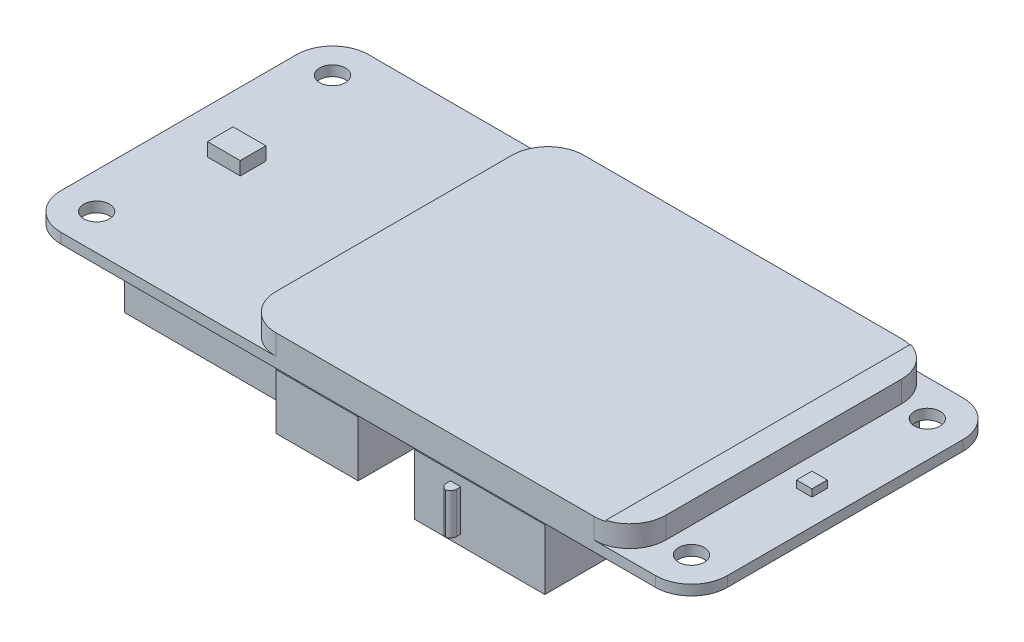
from build123d import *

# Parameters (mm, degrees)
SKETCH_1_R         = 1.25
BOARD_DEPTH        = 1
SKETCH_2_W         = 38
SKETCH_2_H         = 30
SCREEN_DEPTH       = 2
SCREEN_RADIUS_R    = 3.5
SCREEN_TOP_START   = 0.1
SCREEN_TOP_DEPTH   = 0.1
SKETCH_3_W         = 51
SKETCH_3_H         = 5
PLUG_DEPTH         = 5.2
SKETCH_4_W         = 15.14
SKETCH_4_H         = 20
SPEAKER_DEPTH      = 5
SKETCH_10_W        = 8
SKETCH_10_H        = 6
SPEAKER2PLUG_DEPTH = 5.5
SKETCH_5_W         = 12.7
SKETCH_5_H         = 6
BUTTON_DEPTH       = 6
SKETCH_6_W         = 1
SKETCH_6_H         = 4
BUTTON_TAP_DEPTH   = 1
TAP_RADIUS_R       = 0.6
SKETCH_7_W         = 1.5
SKETCH_7_H         = 1.5
RGB_LED_DEPTH      = 0.7
SKETCH_8_W         = 3.2
SKETCH_8_H         = 2.5
MIC_DEPTH          = 1.3
SKETCH_11_W        = 26.2
SKETCH_11_H        = 0.1
SPLIT_2_DEPTH      = 1


with BuildPart() as part:
    # 草图1 → board (new body)
    with BuildSketch(Plane(origin=(0, 0, 0), x_dir=(1, 0, 0), z_dir=(0, 1, 0))):
        with BuildLine():
            Line((-29, 15), (29, 15))
            ThreePointArc((29, 15), (31.474873734, 13.974873734), (32.5, 11.5))
            Line((32.5, 11.5), (32.5, -11.5))
            ThreePointArc((32.5, -11.5), (31.474873734, -13.974873734), (29, -15))
            Line((29, -15), (-29, -15))
            ThreePointArc((-29, -15), (-31.474873734, -13.974873734), (-32.5, -11.5))
            Line((-32.5, -11.5), (-32.5, 11.5))
            ThreePointArc((-32.5, 11.5), (-31.474873734, 13.974873734), (-29, 15))
        make_face()
        with Locations(Location((-29, 11.5, 0), (0, 0, 270))):
            Circle(SKETCH_1_R, mode=Mode.SUBTRACT)
        with Locations(Location((29, 11.5, 0), (0, 0, 270))):
            Circle(SKETCH_1_R, mode=Mode.SUBTRACT)
        with Locations(Location((-29, -11.5, 0), (0, 0, 270))):
            Circle(SKETCH_1_R, mode=Mode.SUBTRACT)
        with Locations(Location((29, -11.5, 0), (0, 0, 270))):
            Circle(SKETCH_1_R, mode=Mode.SUBTRACT)
    extrude(amount=BOARD_DEPTH)

    # 草图2 → screen (add)
    with BuildSketch(Plane(origin=(0, 1, 0), x_dir=(1, 0, 0), z_dir=(0, 1, 0))):
        with Locations((7.5, 0)):
            Rectangle(SKETCH_2_W, SKETCH_2_H)
    extrude(amount=SCREEN_DEPTH)

    # screen-radius
    screen_radius_edges = [part.edges().sort_by_distance(p)[0] for p in [
        (-11.5, 2, -15),
        (-11.5, 2, 15),
        (26.5, 2, 15),
        (26.5, 2, -15),
    ]]
    fillet(screen_radius_edges, radius=SCREEN_RADIUS_R)

    # 草图9 → screen-top (add)
    with BuildSketch(Plane(origin=(0, 3, 0), x_dir=(1, 0, 0), z_dir=(0, 1, 0)).offset(SCREEN_TOP_START)):
        with BuildLine():
            Line((26.5, -11.5), (26.5, 11.5))
            ThreePointArc((26.5, 11.5), (25.80624304, 13.591650066), (24, 14.854101966))
            Line((24, 14.854101966), (24, -14.854101966))
            ThreePointArc((24, -14.854101966), (25.80624304, -13.591650066), (26.5, -11.5))
        make_face()
    extrude(amount=-SCREEN_TOP_DEPTH)

    # 草图3 → plug (add)
    with BuildSketch(Plane.XZ):
        with Locations((0, -11.75)):
            Rectangle(SKETCH_3_W, SKETCH_3_H)
    extrude(amount=PLUG_DEPTH)

    # 草图4 → speaker (add)
    with BuildSketch(Plane.XZ):
        with Locations((-17.52, 2.68)):
            Rectangle(SKETCH_4_W, SKETCH_4_H)
    extrude(amount=SPEAKER_DEPTH)

    # 草图10 → speaker2plug (add)
    with BuildSketch(Plane.XZ):
        with Locations((-4, 12)):
            Rectangle(SKETCH_10_W, SKETCH_10_H)
    extrude(amount=SPEAKER2PLUG_DEPTH)

    # 草图5 → button (add)
    with BuildSketch(Plane.XZ):
        with Locations((11.85, 12)):
            Rectangle(SKETCH_5_W, SKETCH_5_H)
    extrude(amount=BUTTON_DEPTH)

    # 草图6 → button-tap (add)
    with BuildSketch(Plane.XY.offset(15)):
        with Locations((9.5, -3)):
            Rectangle(SKETCH_6_W, SKETCH_6_H)
    extrude(amount=BUTTON_TAP_DEPTH)

    # tap-radius
    # the kernel refuses this fillet: 0.6 mm, written as the material it takes off along each edge
    with BuildSketch(Plane(origin=(10, 0.5, 16), x_dir=(0, 0, -1), z_dir=(0, -1, 0)), Plane(origin=(9, -6.5, 16), x_dir=(0, 0, -1), z_dir=(0, 1, 0))) as tap_radius_piece_1:
        with BuildLine():
            CenterArc((TAP_RADIUS_R, -TAP_RADIUS_R), TAP_RADIUS_R, 90, 90)
            Line((0, -TAP_RADIUS_R), (0, 0))
            Line((0, 0), (TAP_RADIUS_R, 0))
        make_face()
    extrude(amount=7, mode=Mode.SUBTRACT)

    # 草图7 → rgb-led (add)
    with BuildSketch(Plane(origin=(0, 1, 0), x_dir=(1, 0, 0), z_dir=(0, 1, 0))):
        with Locations((29.25, 0)):
            Rectangle(SKETCH_7_W, SKETCH_7_H)
    extrude(amount=RGB_LED_DEPTH)

    # 草图8 → mic (add)
    with BuildSketch(Plane(origin=(0, 1, 0), x_dir=(1, 0, 0), z_dir=(0, 1, 0))):
        with Locations((-26.6, -0.25)):
            Rectangle(SKETCH_8_W, SKETCH_8_H)
    extrude(amount=MIC_DEPTH)

    # 草图11 → split 2 (cut)
    with BuildSketch(Plane.XY.offset(15)):
        with Locations((5.1, -0.05)):
            Rectangle(SKETCH_11_W, SKETCH_11_H)
    extrude(amount=-SPLIT_2_DEPTH, mode=Mode.SUBTRACT)


solid = part.part
